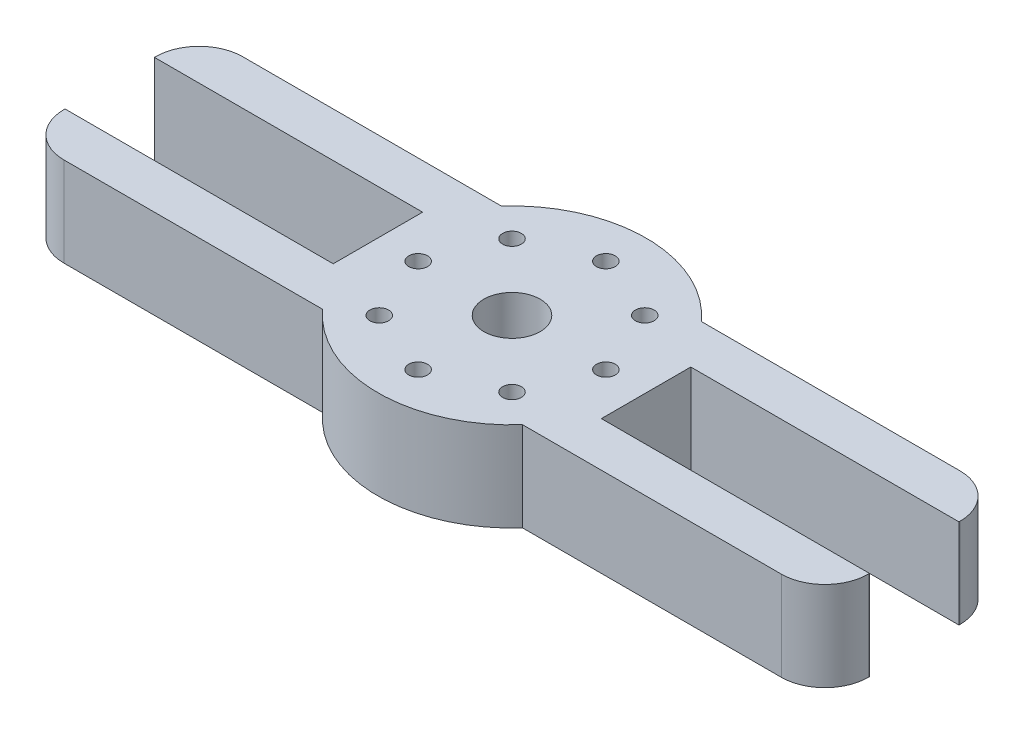
from build123d import *
from build123d.topology import SkipClean

# Parameters (mm, degrees)
BOSS_EXTRUDE1_DEPTH  = 20
SKETCH2_W            = 60
SKETCH2_H            = 20
CUT_EXTRUDE1_DEPTH   = 20
FILLET1_R            = 9.75
FILLET1_OF_MIRROR4_R = 9.75
SKETCH4_R            = 2.1
CUT_EXTRUDE3_DEPTH   = 20


with BuildPart() as part:
    # Sketch1 → Boss-Extrude1 (new body)
    with BuildSketch(Plane(origin=(0, 0, 0), x_dir=(1, 0, 0), z_dir=(0, 1, 0))):
        with BuildLine():
            Line((22.360679775, 20), (90, 20))
            Line((90, 20), (90, -20))
            Line((90, -20), (22.360679775, -20))
            ThreePointArc((22.360679775, -20), (12.247448714, -27.386127875), (0, -30))
            Line((0, -30), (0, -20))
            Line((0, -20), (0, 20))
            Line((0, 20), (0, 30))
            ThreePointArc((0, 30), (12.247448714, 27.386127875), (22.360679775, 20))
        make_face()
    boss_extrude1 = extrude(amount=BOSS_EXTRUDE1_DEPTH)

    # Sketch2 → Cut-Extrude1 (cut)
    with BuildSketch(Plane(origin=(0, 20, 0), x_dir=(1, 0, 0), z_dir=(0, 1, 0))):
        with BuildLine():
            Line((0, 6.3), (0, -6.3))
            ThreePointArc((0, -6.3), (6.3, 0), (0, 6.3))
        make_face()
        with Locations((60, 0)):
            Rectangle(SKETCH2_W, SKETCH2_H)
    cut_extrude1 = extrude(amount=-CUT_EXTRUDE1_DEPTH, mode=Mode.SUBTRACT)

    # Fillet1
    fillet1_edges = [part.edges().sort_by_distance(p)[0] for p in [
        (90, 10, -20),
        (90, 10, 20),
    ]]
    fillet(fillet1_edges, radius=FILLET1_R)

    # Mirror4: Boss-Extrude1, Cut-Extrude1 across plane
    with SkipClean():  # the faces are left unmerged after this step: merging them gives an invalid solid
        add(boss_extrude1.mirror(Plane(origin=(0, 0, 0), x_dir=(0, 0, 1), z_dir=(1, 0, 0))))
        add(cut_extrude1.mirror(Plane(origin=(0, 0, 0), x_dir=(0, 0, 1), z_dir=(1, 0, 0))), mode=Mode.SUBTRACT)
    add(part.part.scale(1), mode=Mode.REPLACE)  # the faces are merged on a copy

    # Fillet1 of Mirror4
    fillet1_of_mirror4_edges = [part.edges().sort_by_distance(p)[0] for p in [
        (-90, 10, -20),
        (-90, 10, 20),
    ]]
    fillet(fillet1_of_mirror4_edges, radius=FILLET1_OF_MIRROR4_R)

    # Sketch4 → Cut-Extrude3 (cut)
    with BuildSketch(Plane(origin=(0, 20, 0), x_dir=(1, 0, 0), z_dir=(0, 1, 0))):
        with Locations(Location((21, 0, 0), (0, 0, 270))):
            Circle(SKETCH4_R)
        with Locations(Location((14.849242405, -14.849242405, 0), (0, 0, 270))):
            Circle(SKETCH4_R)
        with Locations(Location((0, -21, 0), (0, 0, 270))):
            Circle(SKETCH4_R)
        with Locations(Location((-14.849242405, -14.849242405, 0), (0, 0, 270))):
            Circle(SKETCH4_R)
        with Locations(Location((-21, 0, 0), (0, 0, 270))):
            Circle(SKETCH4_R)
        with Locations(Location((-14.849242405, 14.849242405, 0), (0, 0, 270))):
            Circle(SKETCH4_R)
        with Locations(Location((0, 21, 0), (0, 0, 270))):
            Circle(SKETCH4_R)
        with Locations(Location((14.849242405, 14.849242405, 0), (0, 0, 270))):
            Circle(SKETCH4_R)
    extrude(amount=-CUT_EXTRUDE3_DEPTH, mode=Mode.SUBTRACT)


solid = part.part
